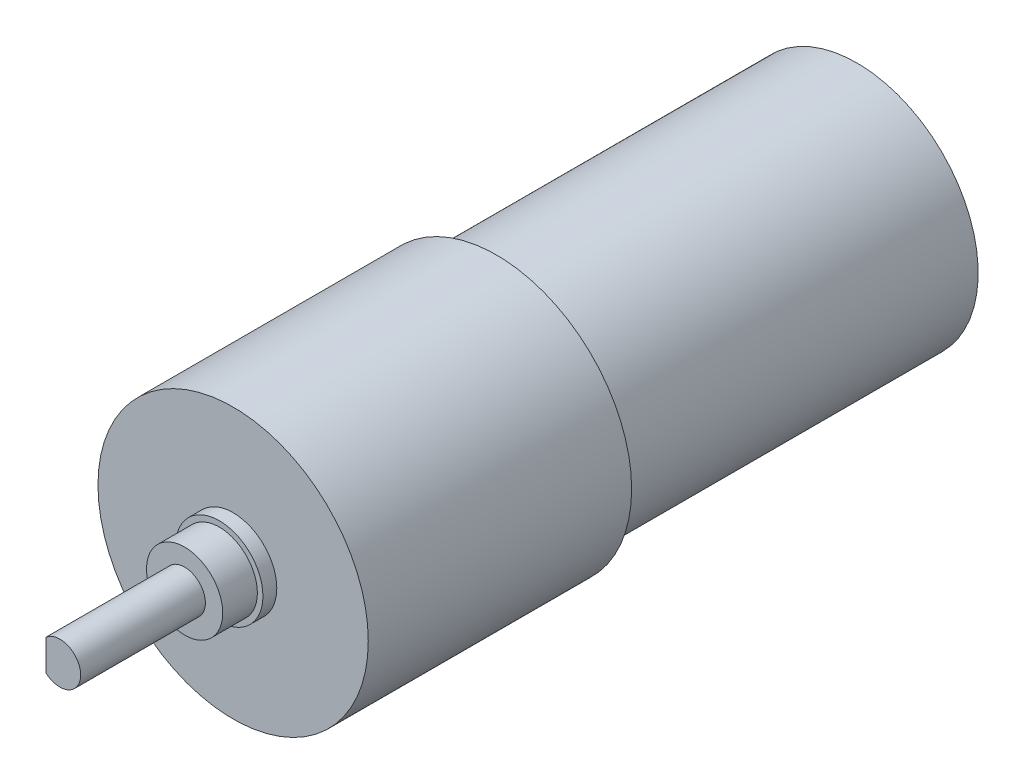
from build123d import *

# Parameters (mm, degrees)
SKETCH1_R           = 8.75
BOSS_EXTRUDE1_DEPTH = 26
SKETCH2_R           = 9.75
BOSS_EXTRUDE2_DEPTH = 19
SKETCH3_R           = 3.15
BOSS_EXTRUDE3_DEPTH = 1
SKETCH4_R           = 2.75
BOSS_EXTRUDE4_DEPTH = 2.5
BOSS_EXTRUDE5_DEPTH = 9


with BuildPart() as part:
    # Sketch1 → Boss-Extrude1 (new body)
    with BuildSketch(Plane.XY):
        Circle(SKETCH1_R)
    extrude(amount=BOSS_EXTRUDE1_DEPTH)

    # Sketch2 → Boss-Extrude2 (add)
    with BuildSketch(Plane.XY.offset(26)):
        Circle(SKETCH2_R)
    extrude(amount=BOSS_EXTRUDE2_DEPTH)

    # Sketch3 → Boss-Extrude3 (add)
    with BuildSketch(Plane.XY.offset(45)):
        Circle(SKETCH3_R)
    extrude(amount=BOSS_EXTRUDE3_DEPTH)

    # Sketch4 → Boss-Extrude4 (add)
    with BuildSketch(Plane.XY.offset(46)):
        Circle(SKETCH4_R)
    extrude(amount=BOSS_EXTRUDE4_DEPTH)

    # Sketch5 → Boss-Extrude5 (add)
    with BuildSketch(Plane.XY.offset(48.5)):
        with BuildLine():
            Line((-1, 1.118033989), (-1, -1.118033989))
            ThreePointArc((-1, -1.118033989), (1.5, 0), (-1, 1.118033989))
        make_face()
    extrude(amount=BOSS_EXTRUDE5_DEPTH)


solid = part.part
